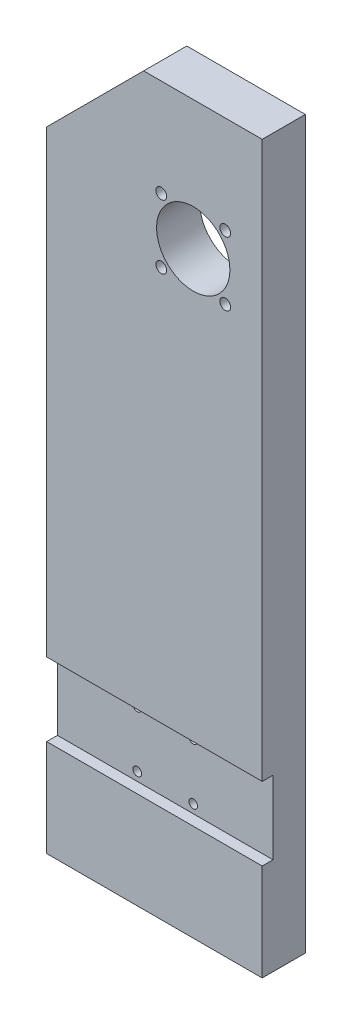
from build123d import *

# Parameters (mm, degrees)
SKETCH1_W           = 100
SKETCH1_H           = 337
SKETCH1_R           = 17
SKETCH1_R_2         = 2.5
SKETCH1_R_3         = 2
BOSS_EXTRUDE1_DEPTH = 20
CHAMFER1_SIZE       = 45
SKETCH2_W           = 100
SKETCH2_H           = 34
CUT_EXTRUDE1_DEPTH  = 5


with BuildPart() as part:
    # Sketch1 → Boss-Extrude1 (new body)
    with BuildSketch(Plane.XY):
        with Locations((47.704546062, 452.000370419)):
            Rectangle(SKETCH1_W, SKETCH1_H)
        with Locations((65.704546062, 560.500370419)):
            Circle(SKETCH1_R, mode=Mode.SUBTRACT)
        with Locations((80.553788467, 575.349612824)):
            Circle(SKETCH1_R_2, mode=Mode.SUBTRACT)
        with Locations((80.553788467, 545.651128014)):
            Circle(SKETCH1_R_2, mode=Mode.SUBTRACT)
        with Locations((50.855303657, 545.651128014)):
            Circle(SKETCH1_R_2, mode=Mode.SUBTRACT)
        with Locations((50.855303657, 575.349612824)):
            Circle(SKETCH1_R_2, mode=Mode.SUBTRACT)
        with Locations((34.704546062, 358.500370419)):
            Circle(SKETCH1_R_3, mode=Mode.SUBTRACT)
        with Locations((60.704546062, 358.500370419)):
            Circle(SKETCH1_R_3, mode=Mode.SUBTRACT)
        with Locations((60.704546062, 332.500370419)):
            Circle(SKETCH1_R_3, mode=Mode.SUBTRACT)
        with Locations((34.704546062, 332.500370419)):
            Circle(SKETCH1_R_3, mode=Mode.SUBTRACT)
    extrude(amount=BOSS_EXTRUDE1_DEPTH)

    # Chamfer1
    chamfer1_edges = [part.edges().sort_by_distance(p)[0] for p in [
        (-2.295453938, 620.500370419, 10),
    ]]
    chamfer(chamfer1_edges, length=CHAMFER1_SIZE)

    # Sketch2 → Cut-Extrude1 (cut)
    with BuildSketch(Plane.XY.offset(20)):
        with Locations((47.704546062, 345.500370419)):
            Rectangle(SKETCH2_W, SKETCH2_H)
    extrude(amount=-CUT_EXTRUDE1_DEPTH, mode=Mode.SUBTRACT)


solid = part.part
